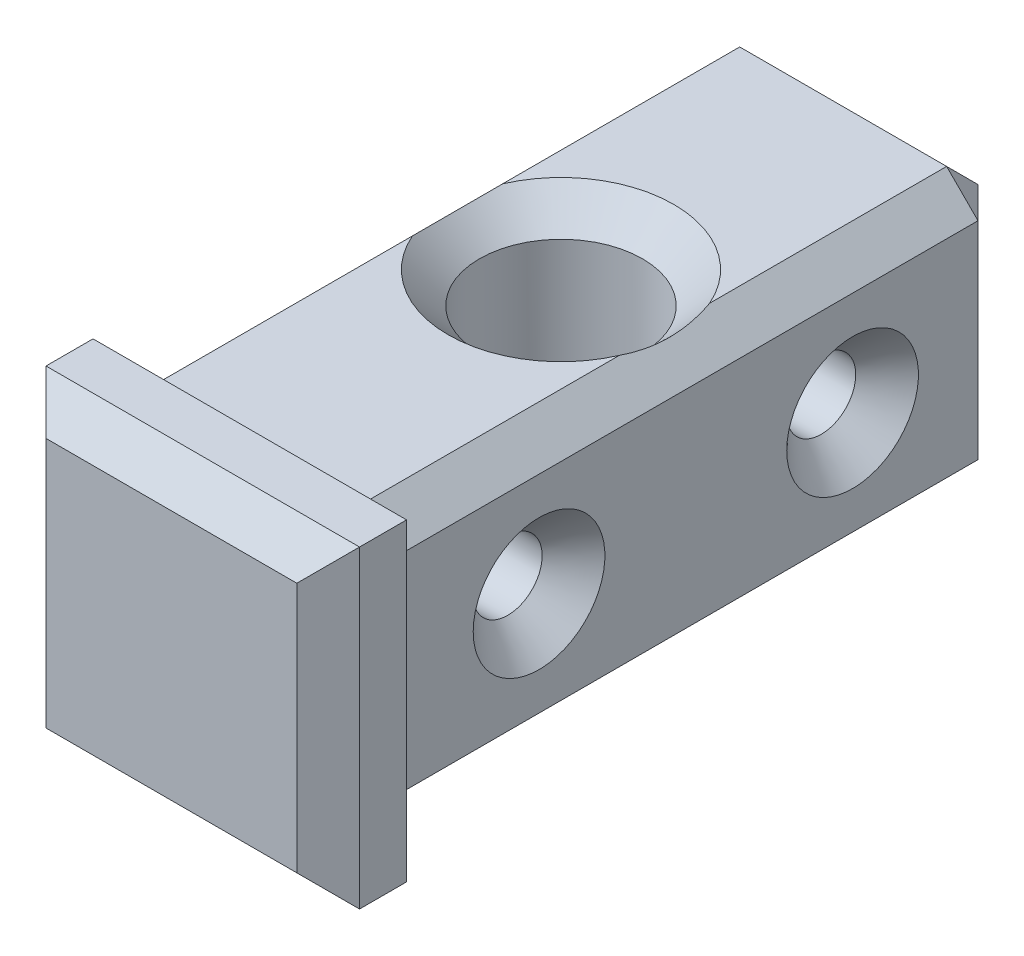
from build123d import *

# Parameters (mm, degrees)
SKETCH1_W           = 21.844
SKETCH1_H           = 21.844
BOSS_EXTRUDE2_DEPTH = 50.8
SKETCH2_W           = 25.4
SKETCH2_H           = 25.4
BOSS_EXTRUDE3_DEPTH = 6.35
SKETCH4_R           = 2.794
CUT_EXTRUDE2_DEPTH  = 67.198133271
SKETCH5_R           = 6.604
CUT_EXTRUDE3_DEPTH  = 67.33394917


with BuildPart() as part:
    # Sketch1 → Boss-Extrude2 (new body)
    with BuildSketch(Plane.XY):
        with Locations((10.922, 10.922)):
            Rectangle(SKETCH1_W, SKETCH1_H)
    extrude(amount=BOSS_EXTRUDE2_DEPTH)

    # Sketch2 → Boss-Extrude3 (add)
    with BuildSketch(Plane.XY.offset(50.8)):
        with Locations((11.1125, 10.7315)):
            Rectangle(SKETCH2_W, SKETCH2_H)
    extrude(amount=BOSS_EXTRUDE3_DEPTH)

    # Sketch4 → Cut-Extrude2 (cut, through all)
    with BuildSketch(Plane.ZY):
        with Locations((38.1, 10.922)):
            Circle(SKETCH4_R)
        with Locations((12.7, 10.922)):
            Circle(SKETCH4_R)
    extrude(amount=-CUT_EXTRUDE2_DEPTH, mode=Mode.SUBTRACT)

    # Sketch5 → Cut-Extrude3 (cut, through all)
    with BuildSketch(Plane(origin=(0, 21.844, 0), x_dir=(1, 0, 0), z_dir=(0, 1, 0))):
        with Locations(Location((10.922, -25.4, 0), (0, 0, 270))):
            Circle(SKETCH5_R)
    extrude(amount=-CUT_EXTRUDE3_DEPTH, mode=Mode.SUBTRACT)

    # Chamfer2
    # the kernel refuses this chamfer: 2.54 mm, written as the material it takes off along each edge
    with BuildSketch(Plane(origin=(20.150666667, 20.150666667, 1.693333333), x_dir=(0, -0.7071067811865474, -0.7071067811865477), z_dir=(0.5773502691896258, 0.5773502691896258, -0.5773502691896255)), Plane(origin=(1.693333333, 20.150666667, 1.693333333), x_dir=(-0.7071067811865476, -0.7071067811865476, 0), z_dir=(-0.5773502691896257, 0.5773502691896257, -0.5773502691896258)), Plane(origin=(20.150666667, 1.693333333, 1.693333333), x_dir=(0, -0.7071067811865476, 0.7071067811865474), z_dir=(0.5773502691896257, -0.5773502691896256, -0.5773502691896257))) as chamfer2_piece_1:
        Polygon((-1.796051224, 1.036950658), (1.796051224, 1.036950658), (0, -2.073901316), align=None)
    extrude(amount=3.226233304, mode=Mode.SUBTRACT)
    with BuildSketch(Plane(origin=(1.693333333, 1.693333333, 1.693333333), x_dir=(0.7071067811865476, 0, -0.7071067811865474), z_dir=(-0.5773502691896255, -0.5773502691896256, -0.5773502691896261))) as chamfer2_piece_2:
        Polygon((-1.796051224, -1.036950658), (1.796051224, -1.036950658), (0, 2.073901316), align=None)
    extrude(amount=3.226233304, mode=Mode.SUBTRACT)
    with BuildSketch(Plane(origin=(-1.5875, 29.963574789, 57.15), x_dir=(-0.027495876610586334, 0, -0.9996219169112968), z_dir=(0, -1, 0)), Plane(origin=(-8.119574789, -1.9685, 57.15), x_dir=(0, -0.02749587661058642, -0.9996219169112968), z_dir=(1, 0, 0)), Plane(origin=(23.8125, -8.500574789, 57.15), x_dir=(0.02749587661058591, 0, -0.9996219169112968), z_dir=(0, 1, 0))) as chamfer2_piece_3:
        with BuildLine():
            Line((2.612829916, 0), (-0.143629773, 2.608879196))
            Line((-0.143629773, 2.608879196), (-0.194410567, 2.607482405))
            ThreePointArc((-0.194410567, 2.607482405), (-0.086688237, 1.304030487), (-0.050780793, -0.001396791))
            Line((-0.050780793, -0.001396791), (0.001396791, -0.050780793))
            ThreePointArc((0.001396791, -0.050780793), (1.306824068, -0.01487335), (2.614226706, -0.050780793))
            Line((2.614226706, -0.050780793), (2.612829916, 0))
        make_face()
    extrude(amount=38.464149579, mode=Mode.SUBTRACT)
    with BuildSketch(Plane(origin=(30.344574789, 23.4315, 57.15), x_dir=(0, -0.9996219169112966, 0.027495876610587302), z_dir=(-1, 0, 0))) as chamfer2_piece_4:
        with BuildLine():
            Line((2.612829916, 0), (-0.143629773, -2.608879196))
            Line((-0.143629773, -2.608879196), (-0.194410567, -2.607482405))
            ThreePointArc((-0.194410567, -2.607482405), (-0.086688237, -1.304030487), (-0.050780793, 0.001396791))
            Line((-0.050780793, 0.001396791), (0.001396791, 0.050780793))
            ThreePointArc((0.001396791, 0.050780793), (1.306824068, 0.01487335), (2.614226706, 0.050780793))
            Line((2.614226706, 0.050780793), (2.612829916, 0))
        make_face()
    extrude(amount=38.464149579, mode=Mode.SUBTRACT)
    with BuildSketch(Plane(origin=(21.844, 10.922, 38.1), x_dir=(0, 0, 1), z_dir=(0, -1, 0))) as chamfer2_piece_5:
        with BuildLine():
            Line((5.405842049, -0.071842049), (2.722157951, 2.611842049))
            Line((2.722157951, 2.611842049), (2.671357951, 2.611842049))
            ThreePointArc((2.671357951, 2.611842049), (2.7432, 1.305921024), (2.7432, 0))
            Line((2.7432, 0), (2.794, -0.0508))
            ThreePointArc((2.794, -0.0508), (4.099921024, -0.0508), (5.405842049, -0.122642049))
            Line((5.405842049, -0.122642049), (5.405842049, -0.071842049))
        make_face()
    revolve(axis=Axis((21.844, 10.922, 38.1), (-1, 0, 0)), mode=Mode.SUBTRACT)
    with BuildSketch(Plane(origin=(0, 10.922, 38.1), x_dir=(0, 0, 1), z_dir=(0, -1, 0))) as chamfer2_piece_6:
        with BuildLine():
            Line((5.405842049, 0.071842049), (2.722157951, -2.611842049))
            Line((2.722157951, -2.611842049), (2.671357951, -2.611842049))
            ThreePointArc((2.671357951, -2.611842049), (2.7432, -1.305921024), (2.7432, 0))
            Line((2.7432, 0), (2.794, 0.0508))
            ThreePointArc((2.794, 0.0508), (4.099921024, 0.0508), (5.405842049, 0.122642049))
            Line((5.405842049, 0.122642049), (5.405842049, 0.071842049))
        make_face()
    revolve(axis=Axis((0, 10.922, 38.1), (-1, 0, 0)), mode=Mode.SUBTRACT)
    with BuildSketch(Plane(origin=(21.844, 10.922, 12.7), x_dir=(0, 0, 1), z_dir=(0, -1, 0))) as chamfer2_piece_7:
        with BuildLine():
            Line((5.405842049, -0.071842049), (2.722157951, 2.611842049))
            Line((2.722157951, 2.611842049), (2.671357951, 2.611842049))
            ThreePointArc((2.671357951, 2.611842049), (2.7432, 1.305921024), (2.7432, 0))
            Line((2.7432, 0), (2.794, -0.0508))
            ThreePointArc((2.794, -0.0508), (4.099921024, -0.0508), (5.405842049, -0.122642049))
            Line((5.405842049, -0.122642049), (5.405842049, -0.071842049))
        make_face()
    revolve(axis=Axis((21.844, 10.922, 12.7), (-1, 0, 0)), mode=Mode.SUBTRACT)
    with BuildSketch(Plane(origin=(0, 10.922, 12.7), x_dir=(0, 0, 1), z_dir=(0, -1, 0))) as chamfer2_piece_8:
        with BuildLine():
            Line((5.405842049, 0.071842049), (2.722157951, -2.611842049))
            Line((2.722157951, -2.611842049), (2.671357951, -2.611842049))
            ThreePointArc((2.671357951, -2.611842049), (2.7432, -1.305921024), (2.7432, 0))
            Line((2.7432, 0), (2.794, 0.0508))
            ThreePointArc((2.794, 0.0508), (4.099921024, 0.0508), (5.405842049, 0.122642049))
            Line((5.405842049, 0.122642049), (5.405842049, 0.071842049))
        make_face()
    revolve(axis=Axis((0, 10.922, 12.7), (-1, 0, 0)), mode=Mode.SUBTRACT)
    with BuildSketch(Plane(origin=(10.922, 0, 25.4), x_dir=(0, 0, 1), z_dir=(-1, 0, 0))) as chamfer2_piece_9:
        with BuildLine():
            Line((9.215842049, -0.071842049), (6.532157951, 2.611842049))
            Line((6.532157951, 2.611842049), (6.481357951, 2.611842049))
            ThreePointArc((6.481357951, 2.611842049), (6.5532, 1.305921024), (6.5532, 0))
            Line((6.5532, 0), (6.604, -0.0508))
            ThreePointArc((6.604, -0.0508), (7.909921024, -0.0508), (9.215842049, -0.122642049))
            Line((9.215842049, -0.122642049), (9.215842049, -0.071842049))
        make_face()
    revolve(axis=Axis((10.922, 0, 25.4), (0, 1, 0)), mode=Mode.SUBTRACT)
    with BuildSketch(Plane(origin=(10.922, 21.844, 25.4), x_dir=(0, 0, 1), z_dir=(-1, 0, 0))) as chamfer2_piece_10:
        with BuildLine():
            Line((9.215842049, 0.071842049), (6.532157951, -2.611842049))
            Line((6.532157951, -2.611842049), (6.481357951, -2.611842049))
            ThreePointArc((6.481357951, -2.611842049), (6.5532, -1.305921024), (6.5532, 0))
            Line((6.5532, 0), (6.604, 0.0508))
            ThreePointArc((6.604, 0.0508), (7.909921024, 0.0508), (9.215842049, 0.122642049))
            Line((9.215842049, 0.122642049), (9.215842049, 0.071842049))
        make_face()
    revolve(axis=Axis((10.922, 21.844, 25.4), (0, 1, 0)), mode=Mode.SUBTRACT)
    with BuildSketch(Plane(origin=(28.376074789, 21.844, 0), x_dir=(0, 0.027495876610585925, 0.9996219169112968), z_dir=(-1, 0, 0)), Plane(origin=(21.844, -6.532074789, 0), x_dir=(0.027495876610585925, 0, 0.9996219169112968), z_dir=(0, 1, 0)), Plane(origin=(-6.532074789, 0, 0), x_dir=(0, -0.027495876610586376, 0.9996219169112968), z_dir=(1, 0, 0)), Plane(origin=(0, 28.376074789, 0), x_dir=(-0.027495876610586376, 0, 0.9996219169112968), z_dir=(0, -1, 0))) as chamfer2_piece_11:
        with BuildLine():
            Line((2.612829916, 0), (-0.143629773, -2.608879196))
            Line((-0.143629773, -2.608879196), (-0.194410567, -2.607482405))
            ThreePointArc((-0.194410567, -2.607482405), (-0.086688237, -1.304030487), (-0.050780793, 0.001396791))
            Line((-0.050780793, 0.001396791), (0.001396791, 0.050780793))
            ThreePointArc((0.001396791, 0.050780793), (1.306824068, 0.01487335), (2.614226706, 0.050780793))
            Line((2.614226706, 0.050780793), (2.612829916, 0))
        make_face()
    extrude(amount=34.908149579, mode=Mode.SUBTRACT)
    with BuildSketch(Plane(origin=(0, 21.844, -6.532074789), x_dir=(0.9996219169112968, 0.027495876610585935, 0), z_dir=(0, 0, 1)), Plane(origin=(21.844, 21.844, -6.532074789), x_dir=(0.02749587661058595, -0.9996219169112968, 0), z_dir=(0, 0, 1)), Plane(origin=(21.844, 0, -6.532074789), x_dir=(-0.9996219169112966, -0.0274958766105864, 0), z_dir=(0, 0, 1))) as chamfer2_piece_12:
        with BuildLine():
            Line((2.612829916, 0), (-0.143629773, -2.608879196))
            Line((-0.143629773, -2.608879196), (-0.194410567, -2.607482405))
            ThreePointArc((-0.194410567, -2.607482405), (-0.086688237, -1.304030487), (-0.050780793, 0.001396791))
            Line((-0.050780793, 0.001396791), (0.001396791, 0.050780793))
            ThreePointArc((0.001396791, 0.050780793), (1.306824068, 0.01487335), (2.614226706, 0.050780793))
            Line((2.614226706, 0.050780793), (2.612829916, 0))
        make_face()
    extrude(amount=57.332074789, mode=Mode.SUBTRACT)
    with BuildSketch(Plane(origin=(0, 0, -6.532074789), x_dir=(0.9996219169112966, -0.02749587661058636, 0), z_dir=(0, 0, 1))) as chamfer2_piece_13:
        with BuildLine():
            Line((2.612829916, 0), (-0.143629773, 2.608879196))
            Line((-0.143629773, 2.608879196), (-0.194410567, 2.607482405))
            ThreePointArc((-0.194410567, 2.607482405), (-0.086688237, 1.304030487), (-0.050780793, -0.001396791))
            Line((-0.050780793, -0.001396791), (0.001396791, -0.050780793))
            ThreePointArc((0.001396791, -0.050780793), (1.306824068, -0.01487335), (2.614226706, -0.050780793))
            Line((2.614226706, -0.050780793), (2.612829916, 0))
        make_face()
    extrude(amount=57.332074789, mode=Mode.SUBTRACT)


solid = part.part
